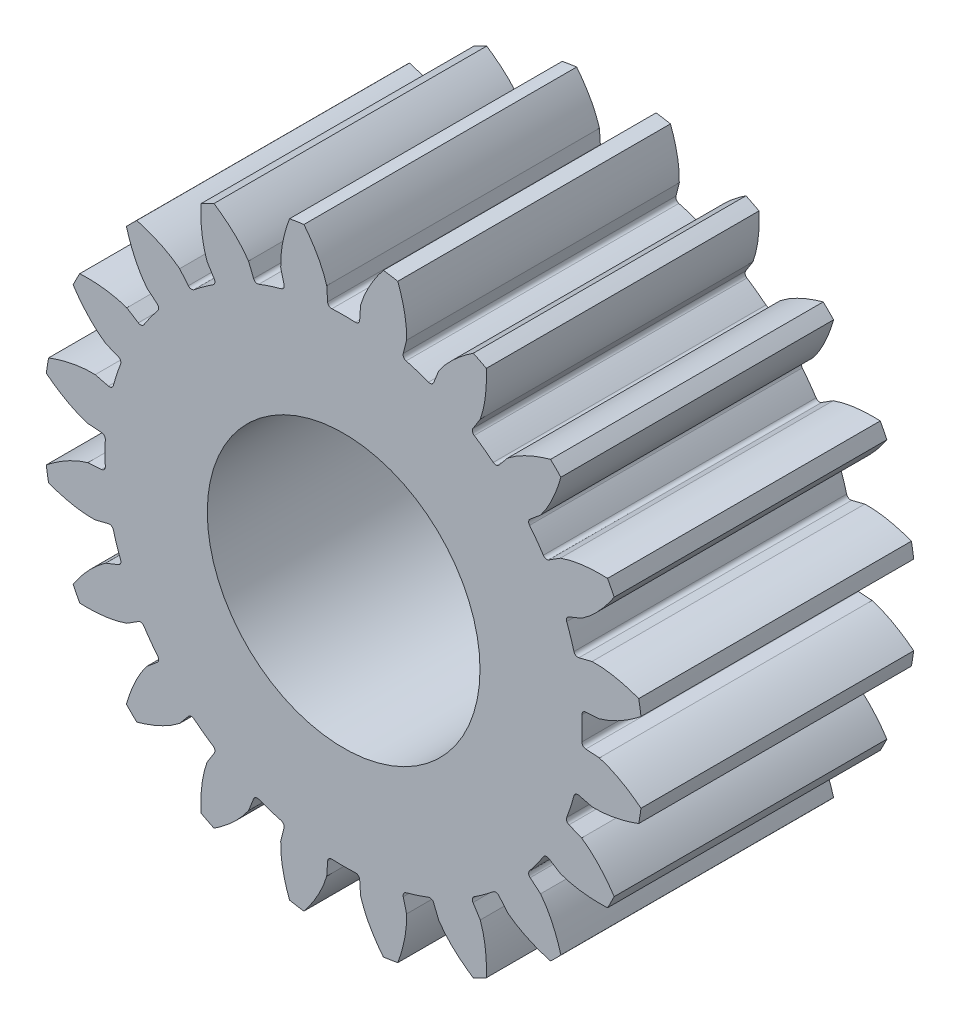
from build123d import *

# Parameters (mm, degrees)
SKETCH_968_R                     = 22
EXTRUDE_988_DEPTH                = 10
CUT_EXTRUDE_1336_DEPTH           = 10
FILLET_1_R                       = 0.3
PATTERN_CIRCULAR_1_COUNT         = 20
FILLET_1_OF_PATTERN_CIRCULAR_1_R = 0.3
SKETCH_3_R                       = 10
CUT_EXTRUDE_1_DEPTH              = 37.756587424


with BuildPart() as part:
    # Sketch 968 → Extrude 988 (new, symmetric)
    with BuildSketch(Plane.XY):
        Circle(SKETCH_968_R)
    extrude(amount=EXTRUDE_988_DEPTH, both=True)

    # 草图2 → Cut-Extrude 1336 (cut, symmetric)
    with BuildSketch(Plane.XY):
        with BuildLine():
            Line((-1.241170332, 18.752823383), (-1.155722644, 17.461795588))
            ThreePointArc((-1.155722644, 17.461795588), (0, 17.5), (1.155722644, 17.461795588))
            Line((1.155722644, 17.461795588), (1.241170332, 18.752823383))
            add(Edge.make_bspline(
                [(1.241170332, 18.752823383), (1.264662051, 18.836311479), (1.327063106, 19.040300701), (1.459742828, 19.408862934), (1.69180749, 19.929644291), (2.066846164, 20.624586252), (2.432159738, 21.178094272), (2.721054019, 21.566956627), (2.911468156, 21.806497958)],
                knots=[0.007194688, 0.007194688, 0.007194688, 0.007194688, 0.007194688, 0.010661158, 0.015718248, 0.022839082, 0.029959916, 0.042189987, 0.042189987, 0.042189987, 0.042189987, 0.042189987], degree=4))
            ThreePointArc((2.911468156, 21.806497958), (0, 22), (-2.911468156, 21.806497958))
            add(Edge.make_bspline(
                [(-1.241170332, 18.752823383), (-1.264662051, 18.836311479), (-1.327063106, 19.040300701), (-1.459742828, 19.408862935), (-1.69180749, 19.929644292), (-2.066846164, 20.624586253), (-2.432159738, 21.178094273), (-2.721054018, 21.566956627), (-2.911468156, 21.806497958)],
                knots=[0.007194688, 0.007194688, 0.007194688, 0.007194688, 0.007194688, 0.010661158, 0.015718248, 0.022839082, 0.029959916, 0.042189987, 0.042189987, 0.042189987, 0.042189987, 0.042189987], degree=4))
        make_face()
    cut_extrude_1336 = extrude(amount=CUT_EXTRUDE_1336_DEPTH, both=True, mode=Mode.SUBTRACT)

    # 圆角1
    fillet_1_edges = [part.edges().sort_by_distance(p)[0] for p in [
        (1.155722644, 17.461795588, 0),
        (-1.155722644, 17.461795588, 0),
    ]]
    fillet(fillet_1_edges, radius=FILLET_1_R)

    # 圆周阵列1: Cut-Extrude 1336 ×20 about axis
    pattern_circular_1_axis = Axis((0, 0, 10), (0, 0, -1))
    for i in range(1, PATTERN_CIRCULAR_1_COUNT):
        add(cut_extrude_1336.rotate(pattern_circular_1_axis, i * 360 / PATTERN_CIRCULAR_1_COUNT), mode=Mode.SUBTRACT)

    # 圆角1 of 圆周阵列1
    fillet_1_of_pattern_circular_1_edges = [part.edges().sort_by_distance(p)[0] for p in [
        (6.495149141, 16.250016543, 0),
        (4.296834037, 16.964292418, 0),
        (11.198785185, 13.447572657, 0),
        (9.328786665, 14.806206109, 0),
        (14.806206109, 9.328786665, 0),
        (13.447572657, 11.198785185, 0),
        (16.964292418, 4.296834037, 0),
        (16.250016543, 6.495149141, 0),
        (17.461795588, -1.155722644, 0),
        (17.461795588, 1.155722644, 0),
        (16.250016543, -6.495149141, 0),
        (16.964292418, -4.296834037, 0),
        (13.447572657, -11.198785185, 0),
        (14.806206109, -9.328786665, 0),
        (9.328786665, -14.806206109, 0),
        (11.198785185, -13.447572657, 0),
        (4.296834037, -16.964292418, 0),
        (6.495149141, -16.250016543, 0),
        (-1.155722644, -17.461795588, 0),
        (1.155722644, -17.461795588, 0),
        (-6.495149141, -16.250016543, 0),
        (-4.296834037, -16.964292418, 0),
        (-11.198785185, -13.447572657, 0),
        (-9.328786665, -14.806206109, 0),
        (-14.806206109, -9.328786665, 0),
        (-13.447572657, -11.198785185, 0),
        (-16.964292418, -4.296834037, 0),
        (-16.250016543, -6.495149141, 0),
        (-17.461795588, 1.155722644, 0),
        (-17.461795588, -1.155722644, 0),
        (-16.250016543, 6.495149141, 0),
        (-16.964292418, 4.296834037, 0),
        (-13.447572657, 11.198785185, 0),
        (-14.806206109, 9.328786665, 0),
        (-9.328786665, 14.806206109, 0),
        (-11.198785185, 13.447572657, 0),
        (-4.296834037, 16.964292418, 0),
        (-6.495149141, 16.250016543, 0),
    ]]
    fillet(fillet_1_of_pattern_circular_1_edges, radius=FILLET_1_OF_PATTERN_CIRCULAR_1_R)

    # 草图3 → 切除-拉伸1 (cut, through all)
    with BuildSketch(Plane.XY.offset(10)):
        Circle(SKETCH_3_R)
    extrude(amount=-CUT_EXTRUDE_1_DEPTH, mode=Mode.SUBTRACT)


solid = part.part
